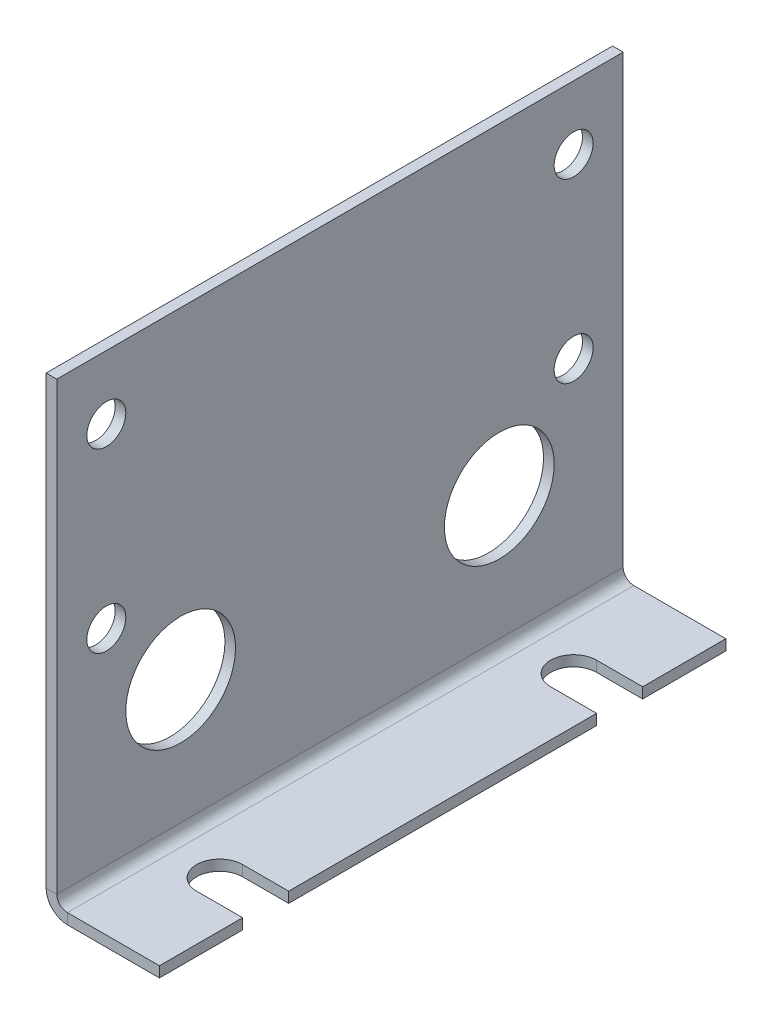
from build123d import *

# Parameters (mm, degrees)
SM_BASE_FLANGE_1_DEPTH = 80
SKETCH_6_R             = 5.5
CUT_EXTRUDE_1_DEPTH    = 10
SKETCH_7_R             = 15.5
CUT_EXTRUDE_2_DEPTH    = 10
CUT_EXTRUDE_3_DEPTH    = 10


# Sheet-metal steps are written as plain solids
with BuildPart() as part:
    # Sketch 1 → Базовая кромка1 (new, symmetric)
    with BuildSketch(Plane.XY):
        with BuildLine():
            Line((0, 129), (0, 3))
            ThreePointArc((0, 3), (0.878679656, 0.878679656), (3, 0))
            Line((3, 0), (29, 0))
            Line((29, 0), (29, -3))
            Line((29, -3), (3, -3))
            ThreePointArc((3, -3), (-1.242640687, -1.242640687), (-3, 3))
            Line((-3, 3), (-3, 129))
            Line((-3, 129), (0, 129))
        make_face()
    extrude(amount=SM_BASE_FLANGE_1_DEPTH, both=True)

    # Эскиз6 → Вырез-Вытянуть1 (cut)
    with BuildSketch(Plane(origin=(0, 0, 0), x_dir=(0, 0, -1), z_dir=(1, 0, 0))):
        with Locations(Location((-66, 111, 0), (0, 0, 90))):
            Circle(SKETCH_6_R)
        with Locations(Location((66, 111, 0), (0, 0, 90))):
            Circle(SKETCH_6_R)
        with Locations(Location((66, 61, 0), (0, 0, 90))):
            Circle(SKETCH_6_R)
        with Locations(Location((-66, 61, 0), (0, 0, 90))):
            Circle(SKETCH_6_R)
    extrude(amount=-CUT_EXTRUDE_1_DEPTH, mode=Mode.SUBTRACT)

    # Эскиз7 → Вырез-Вытянуть2 (cut)
    with BuildSketch(Plane(origin=(0, 0, 0), x_dir=(0, 0, -1), z_dir=(1, 0, 0))):
        with Locations(Location((-45, 38, 0), (0, 0, 90))):
            Circle(SKETCH_7_R)
        with Locations(Location((45, 38, 0), (0, 0, 90))):
            Circle(SKETCH_7_R)
    extrude(amount=-CUT_EXTRUDE_2_DEPTH, mode=Mode.SUBTRACT)

    # Эскиз8 → Вырез-Вытянуть3 (cut)
    with BuildSketch(Plane(origin=(0, 0, 0), x_dir=(1, 0, 0), z_dir=(0, 1, 0))):
        with BuildLine():
            Line((16, -43.5), (29, -43.5))
            ThreePointArc((29, -43.5), (35.5, -50), (29, -56.5))
            Line((29, -56.5), (16, -56.5))
            ThreePointArc((16, -56.5), (9.5, -50), (16, -43.5))
        make_face()
        with BuildLine():
            Line((16, 56.5), (29, 56.5))
            ThreePointArc((29, 56.5), (35.5, 50), (29, 43.5))
            Line((29, 43.5), (16, 43.5))
            ThreePointArc((16, 43.5), (9.5, 50), (16, 56.5))
        make_face()
    extrude(amount=-CUT_EXTRUDE_3_DEPTH, mode=Mode.SUBTRACT)


solid = part.part
